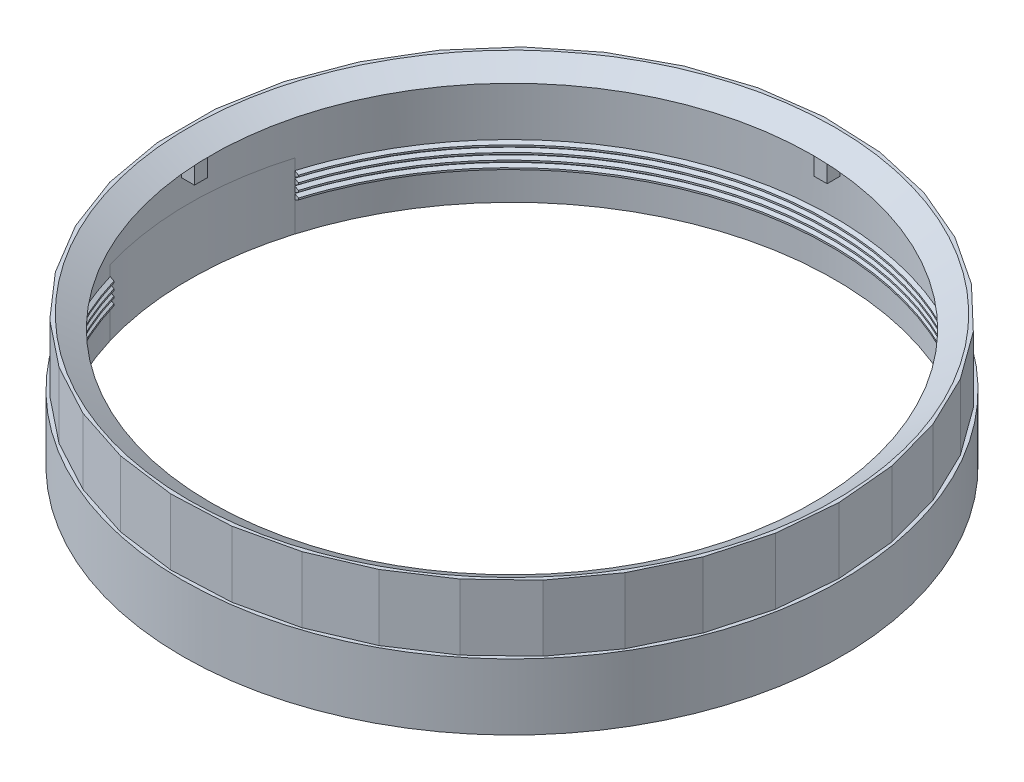
from build123d import *
from build123d.topology import SkipClean

# Parameters (mm, degrees)
SKETCH1_R                           = 25
SKETCH1_R_2                         = 22
BOSS_EXTRUDE1_DEPTH                 = 10
SKETCH4_R                           = 24.5
CUT_EXTRUDE1_DEPTH                  = 9
SKETCH3_R                           = 22
SKETCH5_R                           = 24.5
SKETCH10_R                          = 22
SKETCH9_R                           = 24.5
CUT_EXTRUDE3_START                  = -24.7
SKETCH12_W                          = 5
SKETCH12_H                          = 10
CUT_EXTRUDE3_DEPTH                  = 5
CIRPATTERN1_COUNT                   = 35
THREAD1_PITCH                       = 0.5
CUT_EXTRUDE6_REACH                  = 38.742
CUT_EXTRUDE6_END_RADIUS             = 24.5
SKETCH19_W                          = 14
SKETCH19_H                          = 10
CUT_EXTRUDE6_DIRECTION_2_REACH      = 38.742
CUT_EXTRUDE6_DIRECTION_2_END_RADIUS = 24.5
BOSS_EXTRUDE4_DEPTH                 = 2
BOSS_EXTRUDE4_2_DEPTH               = 2
BOSS_EXTRUDE4_3_DEPTH               = 2
BOSS_EXTRUDE4_4_DEPTH               = 2


with BuildPart() as part:
    # Sketch1 → Boss-Extrude1 (new body)
    with BuildSketch(Plane(origin=(0, 0, 0), x_dir=(1, 0, 0), z_dir=(0, 1, 0))):
        with Locations(Location((0, 0, 0), (0, 0, 270))):
            Circle(SKETCH1_R)
        with Locations(Location((0, 0, 0), (0, 0, 270))):
            Circle(SKETCH1_R_2, mode=Mode.SUBTRACT)
    extrude(amount=BOSS_EXTRUDE1_DEPTH)

    # Sketch4 → Cut-Extrude1 (cut)
    with BuildSketch(Plane(origin=(0, 0, 0), x_dir=(1, 0, 0), z_dir=(0, 1, 0))):
        with Locations(Location((0, 0, 0), (0, 0, 270))):
            Circle(SKETCH4_R)
    extrude(amount=CUT_EXTRUDE1_DEPTH, mode=Mode.SUBTRACT)

    # Sketch3 → Cut-Loft1 section 0
    with BuildSketch(Plane(origin=(0, 9, 0), x_dir=(1, 0, 0), z_dir=(0, 1, 0))):
        Circle(SKETCH3_R)
    # Sketch5 → Cut-Loft1 section 1
    with BuildSketch(Plane(origin=(0, 10, 0), x_dir=(1, 0, 0), z_dir=(0, 1, 0))):
        Circle(SKETCH5_R)
    loft(mode=Mode.SUBTRACT)

    # Sketch10 → Cut-Loft2 section 0
    with BuildSketch(Plane(origin=(0, 8.5, 0), x_dir=(1, 0, 0), z_dir=(0, 1, 0))):
        Circle(SKETCH10_R)
    # Sketch9 → Cut-Loft2 section 1
    with BuildSketch(Plane(origin=(0, 10, 0), x_dir=(1, 0, 0), z_dir=(0, 1, 0))):
        Circle(SKETCH9_R)
    loft(mode=Mode.SUBTRACT)

    # Sketch12 → Cut-Extrude3 (cut)
    with BuildSketch(Plane(origin=(0, 0, 0), x_dir=(0, 0, -1), z_dir=(1, 0, 0)).offset(CUT_EXTRUDE3_START)):
        with Locations((0, 10)):
            Rectangle(SKETCH12_W, SKETCH12_H)
    cut_extrude3 = extrude(amount=-CUT_EXTRUDE3_DEPTH, mode=Mode.SUBTRACT)

    # CirPattern1: Cut-Extrude3 ×35 about axis
    cirpattern1_axis = Axis((0, 0, 0), (0, 1, 0))
    for i in range(1, CIRPATTERN1_COUNT):
        add(cut_extrude3.rotate(cirpattern1_axis, i * 360 / CIRPATTERN1_COUNT), mode=Mode.SUBTRACT)

    # Thread1: the profile of Thread Profile1 profile screwed along a right-hand helix of 4 turns, 6 arcs to a turn; built about Z, then put on its axis
    thread1_z = Axis((0, 0, 0), (0, 0, 1))
    thread1_corners = [(24.5003, 0, -0.000173205), (24.5003, 0, 0.437673204), (24.229367062, 0, 0.281249999), (24.229367062, 0, 0.156249999)]
    with BuildLine(mode=Mode.PRIVATE) as thread1_profile:
        Line(thread1_corners[0], thread1_corners[1])
        Line(thread1_corners[1], thread1_corners[2])
        Line(thread1_corners[2], thread1_corners[3])
        Line(thread1_corners[3], thread1_corners[0])
    thread1_cap = Face(thread1_profile.wire())
    thread1_turn_angles = [0, 30, 60, 90, 120, 150, 180, 210, 240, 270, 300, 330, 360]
    thread1_turn_weights = [1, 0.8660254037844387, 1, 0.8660254037844387, 1, 0.8660254037844387, 1, 0.8660254037844387, 1, 0.8660254037844387, 1, 0.8660254037844387, 1]
    thread1_turn_rails = [Edge.make_bspline([Vector(p[0], p[1], 0).rotate(thread1_z, thread1_turn_angles[k]) / thread1_turn_weights[k] + Vector(0, 0, p[2] + THREAD1_PITCH * thread1_turn_angles[k] / 360) for k in range(13)], [0, 0, 0, 1, 1, 2, 2, 3, 3, 4, 4, 5, 5, 6, 6, 6], 2, thread1_turn_weights) for p in thread1_corners]
    thread1_turn_sides = [Face.make_surface_from_curves(thread1_turn_rails[p[0]], thread1_turn_rails[p[1]]) for p in [(0, 1), (1, 2), (2, 3), (3, 0)]]
    thread1 = Plane(origin=(0, 2, 0), x_dir=(1, 0, 0), z_dir=(0, 1, 0)) * Solid(Shell([*[p.moved(Location((0, 0, THREAD1_PITCH * i))) for i in range(4) for p in thread1_turn_sides], thread1_cap, thread1_cap.rotate(thread1_z, 1440).moved(Location((0, 0, THREAD1_PITCH * 1440 / 360)))]))
    add(thread1)

    # Cut-Extrude6: up to this cylinder (the profile starts inside it)
    cut_extrude6_end = Plane(origin=(0, 0, 0), z_dir=(0, -1, 0)) * Cylinder(CUT_EXTRUDE6_END_RADIUS, 127.484, mode=Mode.PRIVATE)
    # Sketch19 → Cut-Extrude6 (cut, up to the surface)
    with BuildSketch(Plane(origin=(0, 0, 0), x_dir=(0, 0, -1), z_dir=(1, 0, 0)), mode=Mode.PRIVATE) as cut_extrude6_sk1:
        Rectangle(SKETCH19_W, SKETCH19_H)
    cut_extrude6_tool1 = extrude(cut_extrude6_sk1.sketch, amount=-CUT_EXTRUDE6_REACH, mode=Mode.PRIVATE) & cut_extrude6_end
    add(cut_extrude6_tool1.solids().sort_by_distance((0, 0, 0))[0], mode=Mode.SUBTRACT)

    # Cut-Extrude6 direction 2: up to this cylinder (the profile starts inside it)
    with SkipClean():  # the faces are left unmerged after this step: merging them gives an invalid solid
        cut_extrude6_direction_2_end = Plane(origin=(0, 0, 0), z_dir=(0, -1, 0)) * Cylinder(CUT_EXTRUDE6_DIRECTION_2_END_RADIUS, 127.484, mode=Mode.PRIVATE)
        # Sketch19 → Cut-Extrude6 direction 2 (cut, up to the surface)
        with BuildSketch(Plane(origin=(0, 0, 0), x_dir=(0, 0, -1), z_dir=(1, 0, 0)), mode=Mode.PRIVATE) as cut_extrude6_direction_2_sk1:
            Rectangle(SKETCH19_W, SKETCH19_H)
        cut_extrude6_direction_2_tool1 = extrude(cut_extrude6_direction_2_sk1.sketch, amount=CUT_EXTRUDE6_DIRECTION_2_REACH, mode=Mode.PRIVATE) & cut_extrude6_direction_2_end
        add(cut_extrude6_direction_2_tool1.solids().sort_by_distance((0, 0, 0))[0], mode=Mode.SUBTRACT)


with BuildPart() as body_2:
    # Sketch20 → Boss-Extrude4 (new body)
    with BuildSketch(Plane.XZ.offset(-9)):
        Polygon((24.496619676, 0.406969809), (23.496619676, 0.406969809), (23.496619676, -0.593030191), (24.492921737, -0.593030191), align=None)
    extrude(amount=BOSS_EXTRUDE4_DEPTH)


with BuildPart() as body_3:
    # Sketch20 → Boss-Extrude4 2 (new body)
    with BuildSketch(Plane.XZ.offset(-9)):
        Polygon((0.406969809, -24.496619676), (0.406969809, -23.496619676), (-0.593030191, -23.496619676), (-0.593030191, -24.492921737), align=None)
    extrude(amount=BOSS_EXTRUDE4_2_DEPTH)


with BuildPart() as body_4:
    # Sketch20 → Boss-Extrude4 3 (new body)
    with BuildSketch(Plane.XZ.offset(-9)):
        Polygon((-24.496619676, -0.406969809), (-23.496619676, -0.406969809), (-23.496619676, 0.593030191), (-24.492921737, 0.593030191), align=None)
    extrude(amount=BOSS_EXTRUDE4_3_DEPTH)


with BuildPart() as body_5:
    # Sketch20 → Boss-Extrude4 4 (new body)
    with BuildSketch(Plane.XZ.offset(-9)):
        Polygon((-0.406969809, 24.496619676), (-0.406969809, 23.496619676), (0.593030191, 23.496619676), (0.593030191, 24.492921737), align=None)
    extrude(amount=BOSS_EXTRUDE4_4_DEPTH)


solid = Compound([part.part, body_2.part, body_3.part, body_4.part, body_5.part])
